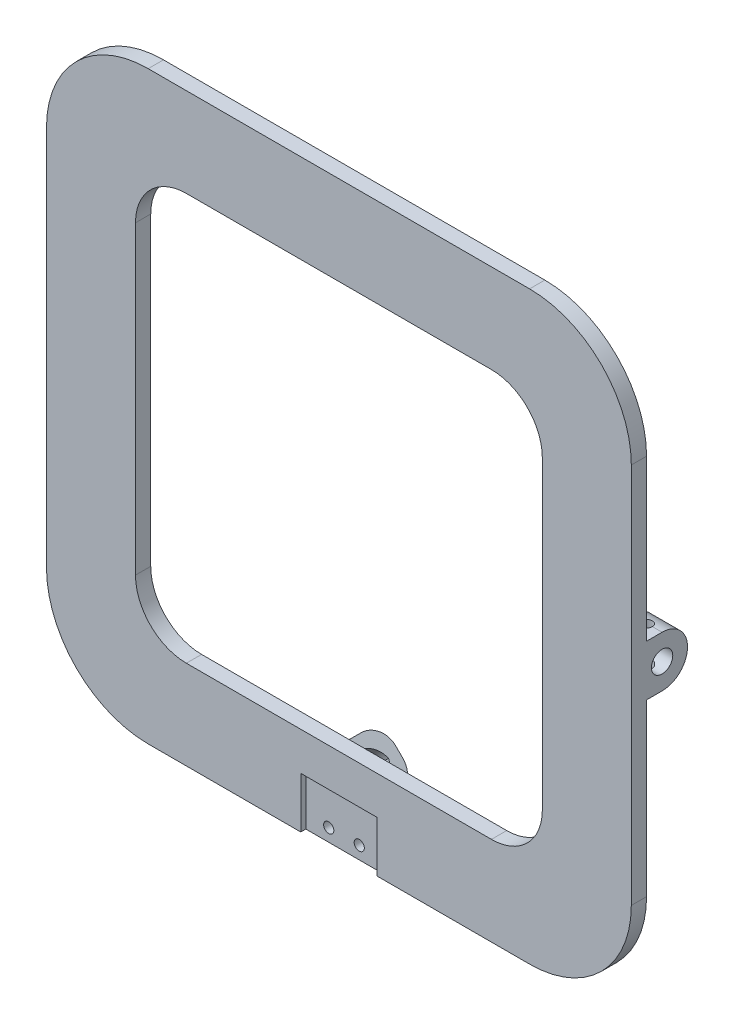
from build123d import *

# Parameters (mm, degrees)
SZKIC1_W                    = 115
SZKIC1_H                    = 115
DODANIE_WYCI_GNI_CIE1_DEPTH = 3
DODANIE_WYCI_GNI_CIE2_DEPTH = 6
SZKIC5_R                    = 2.1
WYTNIJ_WYCI_GNI_CIE1_DEPTH  = 163.833695476
SZKIC6_R                    = 1
WYTNIJ_WYCI_GNI_CIE2_DEPTH  = 10
ZAOKR_GLENIE1_R             = 20
SZKIC7_W                    = 15
SZKIC7_H                    = 10
WYTNIJ_WYCI_GNI_CIE3_DEPTH  = 1
WYTNIJ_WYCI_GNI_CIE4_DEPTH  = 10
SZKIC9_R                    = 1.1
WYTNIJ_WYCI_GNI_CIE5_DEPTH  = 132.613306252
SZKIC10_R                   = 1.1
WYTNIJ_WYCI_GNI_CIE6_DEPTH  = 10
DODANIE_WYCI_GNI_CIE4_DEPTH = 8
SZKIC14_W                   = 6
SZKIC14_H                   = 6
WYTNIJ_WYCI_GNI_CIE8_DEPTH  = 8
ZAOKR_GLENIE3_R             = 4
DODANIE_WYCI_GNI_CIE5_DEPTH = 8
SZKIC16_W                   = 6
SZKIC16_H                   = 6
WYTNIJ_WYCI_GNI_CIE9_DEPTH  = 8
ZAOKR_GLENIE5_R             = 4
SZYK_START                  = 27.034271247
SZYK_LINIOWY1_DEPTH         = 2.5


# Read off the part's stored shape, not the designer's step: Szyk liniowy1
with BuildPart() as part:
    # Szkic1 → Dodanie-wyciągnięcie1 (new body)
    with BuildSketch(Plane.XY):
        with Locations((57.5, -57.5)):
            Rectangle(SZKIC1_W, SZKIC1_H)
    extrude(amount=DODANIE_WYCI_GNI_CIE1_DEPTH)

    # Szkic3 → Dodanie-wyciągnięcie2 (add)
    with BuildSketch(Plane(origin=(115, 0, 0), x_dir=(0, 0, -1), z_dir=(1, 0, 0))):
        with BuildLine():
            Line((0, -51.5), (3.050613798, -51.5))
            ThreePointArc((3.050613798, -51.5), (8.050613798, -56.5), (3.050613798, -61.5))
            Line((3.050613798, -61.5), (0, -61.5))
            Line((0, -61.5), (0, -51.5))
        make_face()
    dodanie_wyci_gni_cie2 = extrude(amount=-DODANIE_WYCI_GNI_CIE2_DEPTH)

    # Lustro1: Dodanie-wyciągnięcie2 across plane
    add(dodanie_wyci_gni_cie2.mirror(Plane(origin=(57.5, 0, 0), x_dir=(0, 0, 1), z_dir=(1, 0, 0))))

    # Szkic5 → Wytnij-wyciągnięcie1 (cut, through all)
    with BuildSketch(Plane(origin=(115, 0, 0), x_dir=(0, 0, -1), z_dir=(1, 0, 0))):
        with Locations(Location((3.050613798, -56.5, 0), (0, 0, 90))):
            Circle(SZKIC5_R)
    extrude(amount=-WYTNIJ_WYCI_GNI_CIE1_DEPTH, mode=Mode.SUBTRACT)

    # Szkic6 → Wytnij-wyciągnięcie2 (cut)
    with BuildSketch(Plane.XY.offset(3)):
        with Locations((54.5, -112.5)):
            Circle(SZKIC6_R)
        with Locations((60.5, -112.5)):
            Circle(SZKIC6_R)
    extrude(amount=-WYTNIJ_WYCI_GNI_CIE2_DEPTH, mode=Mode.SUBTRACT)

    # Zaokrąglenie1
    zaokr_glenie1_edges = [part.edges().sort_by_distance(p)[0] for p in [
        (0, 0, 1.5),
        (115, 0, 1.5),
        (115, -115, 1.5),
        (0, -115, 1.5),
    ]]
    fillet(zaokr_glenie1_edges, radius=ZAOKR_GLENIE1_R)

    # Szkic7 → Wytnij-wyciągnięcie3 (cut)
    with BuildSketch(Plane.XY.offset(3)):
        with Locations((57.5, -110)):
            Rectangle(SZKIC7_W, SZKIC7_H)
    extrude(amount=-WYTNIJ_WYCI_GNI_CIE3_DEPTH, mode=Mode.SUBTRACT)

    # Szkic8 → Wytnij-wyciągnięcie4 (cut)
    with BuildSketch(Plane(origin=(0, 0, 0), x_dir=(-1, 0, 0), z_dir=(0, 0, -1))):
        with BuildLine():
            Line((-87.5, -97.5), (-27.5, -97.5))
            ThreePointArc((-27.5, -97.5), (-20.428932188, -94.571067812), (-17.5, -87.5))
            Line((-17.5, -87.5), (-17.5, -27.5))
            ThreePointArc((-17.5, -27.5), (-20.428932188, -20.428932188), (-27.5, -17.5))
            Line((-27.5, -17.5), (-87.5, -17.5))
            ThreePointArc((-87.5, -17.5), (-94.571067812, -20.428932188), (-97.5, -27.5))
            Line((-97.5, -27.5), (-97.5, -87.5))
            ThreePointArc((-97.5, -87.5), (-94.571067812, -94.571067812), (-87.5, -97.5))
        make_face()
    extrude(amount=-WYTNIJ_WYCI_GNI_CIE4_DEPTH, mode=Mode.SUBTRACT)

    # Szkic9 → Wytnij-wyciągnięcie5 (cut, through all)
    with BuildSketch(Plane(origin=(0, -51.5, 0), x_dir=(1, 0, 0), z_dir=(0, 1, 0))):
        with Locations(Location((3, 3.050613798, 0), (0, 0, 180))):
            Circle(SZKIC9_R)
    extrude(amount=-WYTNIJ_WYCI_GNI_CIE5_DEPTH, mode=Mode.SUBTRACT)

    # Szkic10 → Wytnij-wyciągnięcie6 (cut)
    with BuildSketch(Plane(origin=(0, -51.5, 0), x_dir=(1, 0, 0), z_dir=(0, 1, 0))):
        with Locations(Location((112, 3.050613798, 0), (0, 0, 180))):
            Circle(SZKIC10_R)
    extrude(amount=-WYTNIJ_WYCI_GNI_CIE6_DEPTH, mode=Mode.SUBTRACT)

    # Szkic13 → Dodanie-wyciągnięcie4 (add)
    with BuildSketch(Plane(origin=(0, 2.663945597, 0), x_dir=(-1, 0, 0), z_dir=(0, 0, -1))):
        Polygon((-53.080582618, -103.598349571), (-60.151650429, -110.669417382), (-61.919417382, -108.901650429), (-54.848349571, -101.830582618), align=None)
    extrude(amount=DODANIE_WYCI_GNI_CIE4_DEPTH)

    # Szkic14 → Wytnij-wyciągnięcie8 (cut)
    with BuildSketch(Plane(origin=(-25.258883476, -22.594937879, 0), x_dir=(-0.7071067811865481, 0.707106781186547, 0), z_dir=(-0.707106781186547, -0.7071067811865481, 0))):
        with Locations((-115.788735419, 3)):
            Rectangle(SZKIC14_W, SZKIC14_H)
    extrude(amount=-WYTNIJ_WYCI_GNI_CIE8_DEPTH, mode=Mode.SUBTRACT)

    # Zaokrąglenie3
    # the kernel refuses this fillet: 4 mm, written as the material it adds along each edge
    with BuildSketch(Plane(origin=(58.737436867, -106.591258223, -6), x_dir=(0, 0, 1), z_dir=(0.707106781186547, 0.7071067811865481, 0)), Plane(origin=(54.49479618, -102.348617536, -6), x_dir=(0.7071067811865481, -0.707106781186547, 0), z_dir=(0.707106781186547, 0.7071067811865481, 0))) as zaokr_glenie3_piece_1:
        with BuildLine():
            CenterArc((ZAOKR_GLENIE3_R, -ZAOKR_GLENIE3_R), ZAOKR_GLENIE3_R, 90, 90)
            Line((0, -ZAOKR_GLENIE3_R), (0, 0))
            Line((0, 0), (ZAOKR_GLENIE3_R, 0))
        make_face()
    extrude(amount=2.5)
    # the kernel refuses this fillet: 4 mm, written as the material it takes off along each edge
    with BuildSketch(Plane(origin=(53.080582618, -115.076539597, -8), x_dir=(0, 0, 1), z_dir=(0.7071067811865476, 0.7071067811865476, 0)), Plane(origin=(61.919417382, -92.095569208, -8), x_dir=(0, 0, 1), z_dir=(-0.7071067811865476, -0.7071067811865476, 0))) as zaokr_glenie3_2_piece_1:
        with BuildLine():
            CenterArc((ZAOKR_GLENIE3_R, -ZAOKR_GLENIE3_R), ZAOKR_GLENIE3_R, 90, 90)
            Line((0, -ZAOKR_GLENIE3_R), (0, 0))
            Line((0, 0), (ZAOKR_GLENIE3_R, 0))
        make_face()
    extrude(amount=22.5, mode=Mode.SUBTRACT)

    # Szkic15 → Dodanie-wyciągnięcie5 (add)
    with BuildSketch(Plane(origin=(0, 0, 0), x_dir=(-1, 0, 0), z_dir=(0, 0, -1))):
        Polygon((-104.697591975, -106.465358928), (-106.465358928, -104.697591975), (-99.394291117, -97.626524164), (-97.626524164, -99.394291117), align=None)
    extrude(amount=DODANIE_WYCI_GNI_CIE5_DEPTH)

    # Szkic16 → Wytnij-wyciągnięcie9 (cut)
    with BuildSketch(Plane(origin=(-0.883883476, -0.883883476, 0), x_dir=(-0.7071067811865475, 0.7071067811865477, 0), z_dir=(-0.7071067811865477, -0.7071067811865475, 0))):
        with Locations((-144.31475452, 3)):
            Rectangle(SZKIC16_W, SZKIC16_H)
    extrude(amount=-WYTNIJ_WYCI_GNI_CIE9_DEPTH, mode=Mode.SUBTRACT)

    # Zaokrąglenie5
    # the kernel refuses this fillet: 4 mm, written as the material it adds along each edge
    with BuildSketch(Plane(origin=(99.040737726, -100.808504679, -6), x_dir=(0.7071067811865475, -0.7071067811865477, 0), z_dir=(0.7071067811865477, 0.7071067811865475, 0)), Plane(origin=(103.283378413, -105.051145366, -6), x_dir=(0, 0, 1), z_dir=(0.7071067811865477, 0.7071067811865475, 0))) as zaokr_glenie5_piece_1:
        with BuildLine():
            CenterArc((ZAOKR_GLENIE5_R, -ZAOKR_GLENIE5_R), ZAOKR_GLENIE5_R, 90, 90)
            Line((0, -ZAOKR_GLENIE5_R), (0, 0))
            Line((0, 0), (ZAOKR_GLENIE5_R, 0))
        make_face()
    extrude(amount=2.5)
    # the kernel refuses this fillet: 4 mm, written as the material it takes off along each edge
    with BuildSketch(Plane(origin=(106.465358928, -90.555456352, -8), x_dir=(0, 0, 1), z_dir=(-0.7071067811865476, -0.7071067811865476, 0)), Plane(origin=(97.626524164, -113.53642674, -8), x_dir=(0, 0, 1), z_dir=(0.7071067811865476, 0.7071067811865476, 0))) as zaokr_glenie5_2_piece_1:
        with BuildLine():
            CenterArc((ZAOKR_GLENIE5_R, -ZAOKR_GLENIE5_R), ZAOKR_GLENIE5_R, 90, 90)
            Line((0, -ZAOKR_GLENIE5_R), (0, 0))
            Line((0, 0), (ZAOKR_GLENIE5_R, 0))
        make_face()
    extrude(amount=22.5, mode=Mode.SUBTRACT)

    # Szyk liniowy1 outline → Szyk liniowy1 (add)
    with BuildSketch(Plane(origin=(0, 0, 0), x_dir=(0.7071067811865471, -0.707106781186548, 0), z_dir=(0.707106781186548, 0.707106781186547, 0)).offset(SZYK_START)):
        with BuildLine():
            ThreePointArc((121.030483272, 4), (119.858910397, 6.828427125), (117.030483272, 8))
            Line((117.030483272, 8), (115.030483272, 8))
            ThreePointArc((115.030483272, 8), (112.202056147, 6.828427125), (111.030483272, 4))
            Line((111.030483272, 4), (111.030483272, 0))
            Line((111.030483272, 0), (113.030483272, 0))
            Line((113.030483272, 0), (113.030483272, 2))
            ThreePointArc((113.030483272, 2), (113.868205612, 4.449489743), (116.030483272, 5.872983346))
            ThreePointArc((116.030483272, 5.872983346), (118.192760932, 4.449489743), (119.030483272, 2))
            Line((119.030483272, 2), (119.030483272, 0))
            Line((119.030483272, 0), (121.030483272, 0))
            Line((121.030483272, 0), (121.030483272, 4))
        make_face()
    extrude(amount=SZYK_LINIOWY1_DEPTH)


solid = part.part
